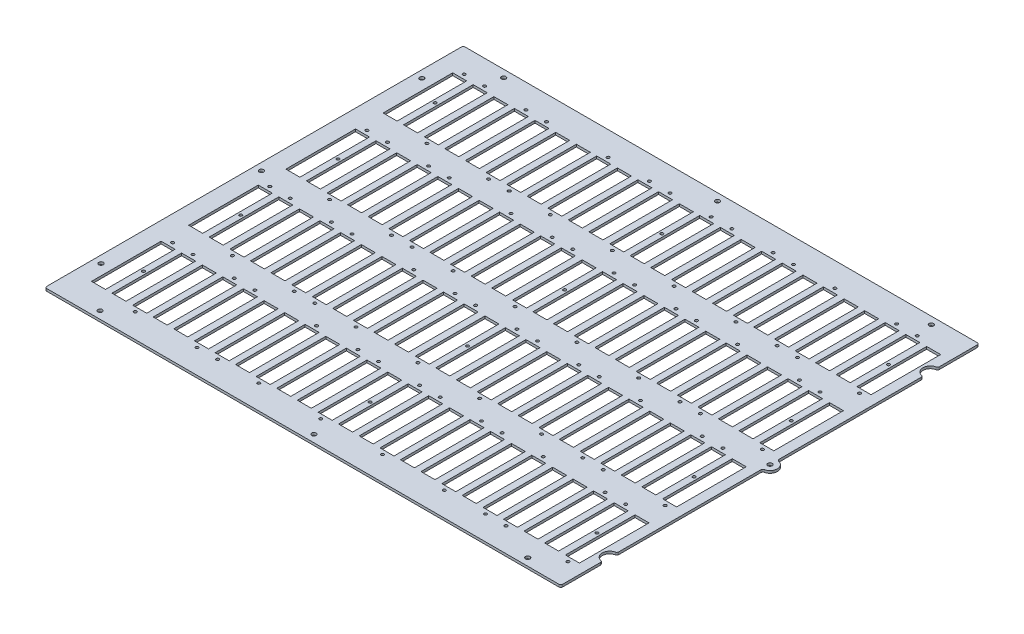
from build123d import *

# Parameters (mm, degrees)
BOSS_EXTRUDE1_DEPTH        = 3.175
SKETCH2_R                  = 1.905
SKETCH2_W                  = 18.288
SKETCH2_H                  = 90.932
CUT_EXTRUDE1_DEPTH         = 3.175
F_1_0_228_DIAMETER_HOLE1_D = 5.7912
FILLET1_R                  = 2.54
CUT_EXTRUDE3_OUTLINE_W     = 18.288
CUT_EXTRUDE3_OUTLINE_H     = 90.932
CUT_EXTRUDE3_OUTLINE_R     = 1.89865
CUT_EXTRUDE3_OUTLINE_R_2   = 2.8956
CUT_EXTRUDE3_OUTLINE_R_3   = 1.905
CUT_EXTRUDE3_DEPTH         = 3.175


# Read off the part's stored shape, not the designer's step: Cut-Extrude3
with BuildPart() as part:
    # Sketch1 → Boss-Extrude1 (new body)
    with BuildSketch(Plane(origin=(0, 0, 0), x_dir=(1, 0, 0), z_dir=(0, 1, 0))):
        with BuildLine():
            Line((337.058, 219.202), (337.058, 273.304))
            Line((337.058, 273.304), (-337.058, 273.304))
            Line((-337.058, 273.304), (-337.058, -273.304))
            Line((-337.058, -273.304), (337.058, -273.304))
            Line((337.058, -273.304), (337.058, -219.202))
            ThreePointArc((337.058, -219.202), (327.406, -209.55), (337.058, -199.898))
            Line((337.058, -199.898), (337.058, -9.652))
            ThreePointArc((337.058, -9.652), (346.71, 0), (337.058, 9.652))
            Line((337.058, 9.652), (337.058, 199.898))
            ThreePointArc((337.058, 199.898), (327.406, 209.55), (337.058, 219.202))
        make_face()
    extrude(amount=BOSS_EXTRUDE1_DEPTH)

    # Sketch2 → Cut-Extrude1 (cut)
    with BuildSketch(Plane(origin=(0, 3.175, 0), x_dir=(1, 0, 0), z_dir=(0, 1, 0))):
        with Locations(Location((-304.313166667, 241.808, 0), (0, 0, 270))):
            Circle(SKETCH2_R)
        with Locations(Location((-250.465166667, 139.192, 0), (0, 0, 270))):
            Circle(SKETCH2_R)
        with Locations(Location((-169.693166667, 139.192, 0), (0, 0, 270))):
            Circle(SKETCH2_R)
        with Locations(Location((-169.693166667, 12.192, 0), (0, 0, 270))):
            Circle(SKETCH2_R)
        with Locations(Location((-196.7865, 241.808, 0), (0, 0, 270))):
            Circle(SKETCH2_R)
        with Locations(Location((-169.693166667, -114.808, 0), (0, 0, 270))):
            Circle(SKETCH2_R)
        with Locations(Location((-169.693166667, -241.808, 0), (0, 0, 270))):
            Circle(SKETCH2_R)
        with Locations(Location((-116.1415, 241.808, 0), (0, 0, 270))):
            Circle(SKETCH2_R)
        with Locations(Location((-250.465166667, 12.192, 0), (0, 0, 270))):
            Circle(SKETCH2_R)
        with Locations(Location((-250.465166667, -114.808, 0), (0, 0, 270))):
            Circle(SKETCH2_R)
        with Locations(Location((-250.465166667, -241.808, 0), (0, 0, 270))):
            Circle(SKETCH2_R)
        with Locations(Location((-277.5585, 241.808, 0), (0, 0, 270))):
            Circle(SKETCH2_R)
        with Locations(Location((-277.5585, 114.808, 0), (0, 0, 270))):
            Circle(SKETCH2_R)
        with Locations(Location((-277.5585, -12.192, 0), (0, 0, 270))):
            Circle(SKETCH2_R)
        with Locations(Location((-277.5585, -139.192, 0), (0, 0, 270))):
            Circle(SKETCH2_R)
        with Locations(Location((-142.769166667, 139.192, 0), (0, 0, 270))):
            Circle(SKETCH2_R)
        with Locations(Location((-142.769166667, 12.192, 0), (0, 0, 270))):
            Circle(SKETCH2_R)
        with Locations(Location((-142.769166667, -114.808, 0), (0, 0, 270))):
            Circle(SKETCH2_R)
        with Locations(Location((-142.769166667, -241.808, 0), (0, 0, 270))):
            Circle(SKETCH2_R)
        with Locations(Location((-62.2935, 241.808, 0), (0, 0, 270))):
            Circle(SKETCH2_R)
        with Locations(Location((-62.2935, 114.808, 0), (0, 0, 270))):
            Circle(SKETCH2_R)
        with Locations(Location((-62.2935, -12.192, 0), (0, 0, 270))):
            Circle(SKETCH2_R)
        with Locations(Location((-62.2935, -139.192, 0), (0, 0, 270))):
            Circle(SKETCH2_R)
        with Locations(Location((-35.3695, 241.808, 0), (0, 0, 270))):
            Circle(SKETCH2_R)
        with Locations(Location((-35.3695, 114.808, 0), (0, 0, 270))):
            Circle(SKETCH2_R)
        with Locations(Location((-35.3695, -12.192, 0), (0, 0, 270))):
            Circle(SKETCH2_R)
        with Locations(Location((-35.3695, -139.192, 0), (0, 0, 270))):
            Circle(SKETCH2_R)
        with Locations(Location((-196.7865, 114.808, 0), (0, 0, 270))):
            Circle(SKETCH2_R)
        with Locations(Location((-8.149166667, 139.192, 0), (0, 0, 270))):
            Circle(SKETCH2_R)
        with Locations(Location((-8.149166667, 12.192, 0), (0, 0, 270))):
            Circle(SKETCH2_R)
        with Locations(Location((-116.1415, 114.808, 0), (0, 0, 270))):
            Circle(SKETCH2_R)
        with Locations(Location((-8.149166667, -114.808, 0), (0, 0, 270))):
            Circle(SKETCH2_R)
        with Locations(Location((-8.149166667, -241.808, 0), (0, 0, 270))):
            Circle(SKETCH2_R)
        with Locations(Location((18.4785, 241.808, 0), (0, 0, 270))):
            Circle(SKETCH2_R)
        with Locations(Location((18.4785, 114.808, 0), (0, 0, 270))):
            Circle(SKETCH2_R)
        with Locations(Location((18.4785, -12.192, 0), (0, 0, 270))):
            Circle(SKETCH2_R)
        with Locations(Location((18.4785, -139.192, 0), (0, 0, 270))):
            Circle(SKETCH2_R)
        with Locations(Location((45.4025, 241.808, 0), (0, 0, 270))):
            Circle(SKETCH2_R)
        with Locations(Location((45.4025, 114.808, 0), (0, 0, 270))):
            Circle(SKETCH2_R)
        with Locations(Location((45.4025, -12.192, 0), (0, 0, 270))):
            Circle(SKETCH2_R)
        with Locations(Location((45.4025, -139.192, 0), (0, 0, 270))):
            Circle(SKETCH2_R)
        with Locations(Location((126.1745, 241.808, 0), (0, 0, 270))):
            Circle(SKETCH2_R)
        with Locations(Location((126.1745, 114.808, 0), (0, 0, 270))):
            Circle(SKETCH2_R)
        with Locations(Location((126.1745, -12.192, 0), (0, 0, 270))):
            Circle(SKETCH2_R)
        with Locations(Location((126.1745, -139.192, 0), (0, 0, 270))):
            Circle(SKETCH2_R)
        with Locations(Location((180.0225, 241.808, 0), (0, 0, 270))):
            Circle(SKETCH2_R)
        with Locations(Location((180.0225, 114.808, 0), (0, 0, 270))):
            Circle(SKETCH2_R)
        with Locations(Location((180.0225, -12.192, 0), (0, 0, 270))):
            Circle(SKETCH2_R)
        with Locations(Location((180.0225, -139.192, 0), (0, 0, 270))):
            Circle(SKETCH2_R)
        with Locations(Location((260.7945, 241.808, 0), (0, 0, 270))):
            Circle(SKETCH2_R)
        with Locations(Location((-196.7865, -12.192, 0), (0, 0, 270))):
            Circle(SKETCH2_R)
        with Locations(Location((260.7945, 114.808, 0), (0, 0, 270))):
            Circle(SKETCH2_R)
        with Locations(Location((260.7945, -12.192, 0), (0, 0, 270))):
            Circle(SKETCH2_R)
        with Locations(Location((-116.1415, -12.192, 0), (0, 0, 270))):
            Circle(SKETCH2_R)
        with Locations(Location((260.7945, -139.192, 0), (0, 0, 270))):
            Circle(SKETCH2_R)
        with Locations(Location((287.7185, 241.808, 0), (0, 0, 270))):
            Circle(SKETCH2_R)
        with Locations(Location((287.7185, 114.808, 0), (0, 0, 270))):
            Circle(SKETCH2_R)
        with Locations(Location((287.7185, -12.192, 0), (0, 0, 270))):
            Circle(SKETCH2_R)
        with Locations(Location((287.7185, -139.192, 0), (0, 0, 270))):
            Circle(SKETCH2_R)
        with Locations(Location((72.622833333, 139.192, 0), (0, 0, 270))):
            Circle(SKETCH2_R)
        with Locations(Location((72.622833333, 12.192, 0), (0, 0, 270))):
            Circle(SKETCH2_R)
        with Locations(Location((72.622833333, -114.808, 0), (0, 0, 270))):
            Circle(SKETCH2_R)
        with Locations(Location((72.622833333, -241.808, 0), (0, 0, 270))):
            Circle(SKETCH2_R)
        with Locations(Location((153.394833333, 139.192, 0), (0, 0, 270))):
            Circle(SKETCH2_R)
        with Locations(Location((153.394833333, 12.192, 0), (0, 0, 270))):
            Circle(SKETCH2_R)
        with Locations(Location((153.394833333, -114.808, 0), (0, 0, 270))):
            Circle(SKETCH2_R)
        with Locations(Location((153.394833333, -241.808, 0), (0, 0, 270))):
            Circle(SKETCH2_R)
        with Locations(Location((207.242833333, 139.192, 0), (0, 0, 270))):
            Circle(SKETCH2_R)
        with Locations(Location((207.242833333, 12.192, 0), (0, 0, 270))):
            Circle(SKETCH2_R)
        with Locations(Location((207.242833333, -114.808, 0), (0, 0, 270))):
            Circle(SKETCH2_R)
        with Locations(Location((207.242833333, -241.808, 0), (0, 0, 270))):
            Circle(SKETCH2_R)
        with Locations(Location((314.938833333, 139.192, 0), (0, 0, 270))):
            Circle(SKETCH2_R)
        with Locations(Location((314.938833333, 12.192, 0), (0, 0, 270))):
            Circle(SKETCH2_R)
        with Locations(Location((-196.7865, -139.192, 0), (0, 0, 270))):
            Circle(SKETCH2_R)
        with Locations(Location((314.938833333, -114.808, 0), (0, 0, 270))):
            Circle(SKETCH2_R)
        with Locations(Location((314.938833333, -241.808, 0), (0, 0, 270))):
            Circle(SKETCH2_R)
        with Locations(Location((-116.1415, -139.192, 0), (0, 0, 270))):
            Circle(SKETCH2_R)
        with Locations(Location((-304.313166667, 114.808, 0), (0, 0, 270))):
            Circle(SKETCH2_R)
        with Locations(Location((-304.313166667, -12.192, 0), (0, 0, 270))):
            Circle(SKETCH2_R)
        with Locations(Location((-304.313166667, -139.192, 0), (0, 0, 270))):
            Circle(SKETCH2_R)
        with Locations((-250.465166667, 190.5)):
            Rectangle(SKETCH2_W, SKETCH2_H)
        with Locations((-169.693166667, 190.5)):
            Rectangle(SKETCH2_W, SKETCH2_H)
        with Locations((-304.313166667, 190.5)):
            Rectangle(SKETCH2_W, SKETCH2_H)
        with Locations((-169.693166667, 63.5)):
            Rectangle(SKETCH2_W, SKETCH2_H)
        with Locations((-169.693166667, -63.5)):
            Rectangle(SKETCH2_W, SKETCH2_H)
        with Locations((-196.7865, 190.5)):
            Rectangle(SKETCH2_W, SKETCH2_H)
        with Locations((-169.693166667, -190.5)):
            Rectangle(SKETCH2_W, SKETCH2_H)
        with Locations((-250.465166667, 63.5)):
            Rectangle(SKETCH2_W, SKETCH2_H)
        with Locations((-116.1415, 190.5)):
            Rectangle(SKETCH2_W, SKETCH2_H)
        with Locations((-250.465166667, -63.5)):
            Rectangle(SKETCH2_W, SKETCH2_H)
        with Locations((-250.465166667, -190.5)):
            Rectangle(SKETCH2_W, SKETCH2_H)
        with Locations((-277.5585, 190.5)):
            Rectangle(SKETCH2_W, SKETCH2_H)
        with Locations((-277.5585, 63.5)):
            Rectangle(SKETCH2_W, SKETCH2_H)
        with Locations((-277.5585, -63.5)):
            Rectangle(SKETCH2_W, SKETCH2_H)
        with Locations((-277.5585, -190.5)):
            Rectangle(SKETCH2_W, SKETCH2_H)
        with Locations((-142.769166667, 190.5)):
            Rectangle(SKETCH2_W, SKETCH2_H)
        with Locations((-142.769166667, 63.5)):
            Rectangle(SKETCH2_W, SKETCH2_H)
        with Locations((-142.769166667, -63.5)):
            Rectangle(SKETCH2_W, SKETCH2_H)
        with Locations((-142.769166667, -190.5)):
            Rectangle(SKETCH2_W, SKETCH2_H)
        with Locations((-62.2935, 190.5)):
            Rectangle(SKETCH2_W, SKETCH2_H)
        with Locations((-62.2935, 63.5)):
            Rectangle(SKETCH2_W, SKETCH2_H)
        with Locations((-62.2935, -63.5)):
            Rectangle(SKETCH2_W, SKETCH2_H)
        with Locations((-62.2935, -190.5)):
            Rectangle(SKETCH2_W, SKETCH2_H)
        with Locations((-35.3695, 190.5)):
            Rectangle(SKETCH2_W, SKETCH2_H)
        with Locations((-35.3695, 63.5)):
            Rectangle(SKETCH2_W, SKETCH2_H)
        with Locations((-35.3695, -63.5)):
            Rectangle(SKETCH2_W, SKETCH2_H)
        with Locations((-35.3695, -190.5)):
            Rectangle(SKETCH2_W, SKETCH2_H)
        with Locations((-8.149166667, 190.5)):
            Rectangle(SKETCH2_W, SKETCH2_H)
        with Locations((-196.7865, 63.5)):
            Rectangle(SKETCH2_W, SKETCH2_H)
        with Locations((-8.149166667, 63.5)):
            Rectangle(SKETCH2_W, SKETCH2_H)
        with Locations((-8.149166667, -63.5)):
            Rectangle(SKETCH2_W, SKETCH2_H)
        with Locations((-116.1415, 63.5)):
            Rectangle(SKETCH2_W, SKETCH2_H)
        with Locations((-8.149166667, -190.5)):
            Rectangle(SKETCH2_W, SKETCH2_H)
        with Locations((18.4785, 190.5)):
            Rectangle(SKETCH2_W, SKETCH2_H)
        with Locations((18.4785, 63.5)):
            Rectangle(SKETCH2_W, SKETCH2_H)
        with Locations((18.4785, -63.5)):
            Rectangle(SKETCH2_W, SKETCH2_H)
        with Locations((18.4785, -190.5)):
            Rectangle(SKETCH2_W, SKETCH2_H)
        with Locations((45.4025, 190.5)):
            Rectangle(SKETCH2_W, SKETCH2_H)
        with Locations((45.4025, 63.5)):
            Rectangle(SKETCH2_W, SKETCH2_H)
        with Locations((45.4025, -63.5)):
            Rectangle(SKETCH2_W, SKETCH2_H)
        with Locations((45.4025, -190.5)):
            Rectangle(SKETCH2_W, SKETCH2_H)
        with Locations((126.1745, 190.5)):
            Rectangle(SKETCH2_W, SKETCH2_H)
        with Locations((126.1745, 63.5)):
            Rectangle(SKETCH2_W, SKETCH2_H)
        with Locations((126.1745, -63.5)):
            Rectangle(SKETCH2_W, SKETCH2_H)
        with Locations((126.1745, -190.5)):
            Rectangle(SKETCH2_W, SKETCH2_H)
        with Locations((180.0225, 190.5)):
            Rectangle(SKETCH2_W, SKETCH2_H)
        with Locations((180.0225, 63.5)):
            Rectangle(SKETCH2_W, SKETCH2_H)
        with Locations((180.0225, -63.5)):
            Rectangle(SKETCH2_W, SKETCH2_H)
        with Locations((180.0225, -190.5)):
            Rectangle(SKETCH2_W, SKETCH2_H)
        with Locations((260.7945, 190.5)):
            Rectangle(SKETCH2_W, SKETCH2_H)
        with Locations((260.7945, 63.5)):
            Rectangle(SKETCH2_W, SKETCH2_H)
        with Locations((-196.7865, -63.5)):
            Rectangle(SKETCH2_W, SKETCH2_H)
        with Locations((260.7945, -63.5)):
            Rectangle(SKETCH2_W, SKETCH2_H)
        with Locations((260.7945, -190.5)):
            Rectangle(SKETCH2_W, SKETCH2_H)
        with Locations((-116.1415, -63.5)):
            Rectangle(SKETCH2_W, SKETCH2_H)
        with Locations((287.7185, 190.5)):
            Rectangle(SKETCH2_W, SKETCH2_H)
        with Locations((287.7185, 63.5)):
            Rectangle(SKETCH2_W, SKETCH2_H)
        with Locations((287.7185, -63.5)):
            Rectangle(SKETCH2_W, SKETCH2_H)
        with Locations((287.7185, -190.5)):
            Rectangle(SKETCH2_W, SKETCH2_H)
        with Locations((72.622833333, 190.5)):
            Rectangle(SKETCH2_W, SKETCH2_H)
        with Locations((72.622833333, 63.5)):
            Rectangle(SKETCH2_W, SKETCH2_H)
        with Locations((72.622833333, -63.5)):
            Rectangle(SKETCH2_W, SKETCH2_H)
        with Locations((72.622833333, -190.5)):
            Rectangle(SKETCH2_W, SKETCH2_H)
        with Locations((153.394833333, 190.5)):
            Rectangle(SKETCH2_W, SKETCH2_H)
        with Locations((153.394833333, 63.5)):
            Rectangle(SKETCH2_W, SKETCH2_H)
        with Locations((153.394833333, -63.5)):
            Rectangle(SKETCH2_W, SKETCH2_H)
        with Locations((153.394833333, -190.5)):
            Rectangle(SKETCH2_W, SKETCH2_H)
        with Locations((207.242833333, 190.5)):
            Rectangle(SKETCH2_W, SKETCH2_H)
        with Locations((207.242833333, 63.5)):
            Rectangle(SKETCH2_W, SKETCH2_H)
        with Locations((207.242833333, -63.5)):
            Rectangle(SKETCH2_W, SKETCH2_H)
        with Locations((207.242833333, -190.5)):
            Rectangle(SKETCH2_W, SKETCH2_H)
        with Locations((314.938833333, 190.5)):
            Rectangle(SKETCH2_W, SKETCH2_H)
        with Locations((314.938833333, 63.5)):
            Rectangle(SKETCH2_W, SKETCH2_H)
        with Locations((-196.7865, -190.5)):
            Rectangle(SKETCH2_W, SKETCH2_H)
        with Locations((314.938833333, -63.5)):
            Rectangle(SKETCH2_W, SKETCH2_H)
        with Locations((314.938833333, -190.5)):
            Rectangle(SKETCH2_W, SKETCH2_H)
        with Locations((-116.1415, -190.5)):
            Rectangle(SKETCH2_W, SKETCH2_H)
        with Locations((-304.313166667, 63.5)):
            Rectangle(SKETCH2_W, SKETCH2_H)
        with Locations((-304.313166667, -63.5)):
            Rectangle(SKETCH2_W, SKETCH2_H)
        with Locations((-304.313166667, -190.5)):
            Rectangle(SKETCH2_W, SKETCH2_H)
    extrude(amount=-CUT_EXTRUDE1_DEPTH, mode=Mode.SUBTRACT)

    # #1 (0.228) Diameter Hole1 (through all)
    with Locations(Plane(origin=(0, 3.175, 0), x_dir=(1, 0, 0), z_dir=(0, 1, 0))):
        with Locations((337.058, 0)):
            Hole(F_1_0_228_DIAMETER_HOLE1_D / 2)

    # Fillet1
    fillet1_edges = [part.edges().sort_by_distance(p)[0] for p in [
        (337.058, 1.5875, -273.304),
        (337.058, 1.5875, -219.202),
        (337.058, 1.5875, -199.898),
        (337.058, 1.5875, -9.652),
        (337.058, 1.5875, 9.652),
        (337.058, 1.5875, 199.898),
        (337.058, 1.5875, 219.202),
        (337.058, 1.5875, 273.304),
        (-337.058, 1.5875, 273.304),
        (-337.058, 1.5875, -273.304),
    ]]
    fillet(fillet1_edges, radius=FILLET1_R)

    # Cut-Extrude3 outline → Cut-Extrude3 (cut)
    with BuildSketch(Plane(origin=(0, 0, 0), x_dir=(1, 0, 0), z_dir=(0, 1, 0))):
        with Locations((233.9975, 190.5)):
            Rectangle(CUT_EXTRUDE3_OUTLINE_W, CUT_EXTRUDE3_OUTLINE_H)
        with Locations((99.3775, 190.5)):
            Rectangle(CUT_EXTRUDE3_OUTLINE_W, CUT_EXTRUDE3_OUTLINE_H)
        with Locations((-223.7105, 190.5)):
            Rectangle(CUT_EXTRUDE3_OUTLINE_W, CUT_EXTRUDE3_OUTLINE_H)
        with Locations((-89.0905, 190.5)):
            Rectangle(CUT_EXTRUDE3_OUTLINE_W, CUT_EXTRUDE3_OUTLINE_H)
        with Locations((-223.7105, -190.5)):
            Rectangle(CUT_EXTRUDE3_OUTLINE_W, CUT_EXTRUDE3_OUTLINE_H)
        with Locations((-89.0905, -190.5)):
            Rectangle(CUT_EXTRUDE3_OUTLINE_W, CUT_EXTRUDE3_OUTLINE_H)
        with Locations((233.9975, -190.5)):
            Rectangle(CUT_EXTRUDE3_OUTLINE_W, CUT_EXTRUDE3_OUTLINE_H)
        with Locations((99.3775, -190.5)):
            Rectangle(CUT_EXTRUDE3_OUTLINE_W, CUT_EXTRUDE3_OUTLINE_H)
        with Locations((-223.7105, -63.5)):
            Rectangle(CUT_EXTRUDE3_OUTLINE_W, CUT_EXTRUDE3_OUTLINE_H)
        with Locations((-89.0905, -63.5)):
            Rectangle(CUT_EXTRUDE3_OUTLINE_W, CUT_EXTRUDE3_OUTLINE_H)
        with Locations((233.9975, -63.5)):
            Rectangle(CUT_EXTRUDE3_OUTLINE_W, CUT_EXTRUDE3_OUTLINE_H)
        with Locations((99.3775, -63.5)):
            Rectangle(CUT_EXTRUDE3_OUTLINE_W, CUT_EXTRUDE3_OUTLINE_H)
        with Locations((233.9975, 63.5)):
            Rectangle(CUT_EXTRUDE3_OUTLINE_W, CUT_EXTRUDE3_OUTLINE_H)
        with Locations((-89.0905, 63.5)):
            Rectangle(CUT_EXTRUDE3_OUTLINE_W, CUT_EXTRUDE3_OUTLINE_H)
        with Locations((-223.7105, 63.5)):
            Rectangle(CUT_EXTRUDE3_OUTLINE_W, CUT_EXTRUDE3_OUTLINE_H)
        with Locations((99.3775, 63.5)):
            Rectangle(CUT_EXTRUDE3_OUTLINE_W, CUT_EXTRUDE3_OUTLINE_H)
        with Locations((-290.935833333, -190.5)):
            Circle(CUT_EXTRUDE3_OUTLINE_R)
        with Locations((-290.935833333, -63.5)):
            Circle(CUT_EXTRUDE3_OUTLINE_R)
        with Locations((-290.935833333, 63.5)):
            Circle(CUT_EXTRUDE3_OUTLINE_R)
        with Locations((301.392166667, -190.5)):
            Circle(CUT_EXTRUDE3_OUTLINE_R)
        with Locations((5.228166667, -190.5)):
            Circle(CUT_EXTRUDE3_OUTLINE_R)
        with Locations((301.392166667, -63.5)):
            Circle(CUT_EXTRUDE3_OUTLINE_R)
        with Locations((5.228166667, -63.5)):
            Circle(CUT_EXTRUDE3_OUTLINE_R)
        with Locations((301.392166667, 63.5)):
            Circle(CUT_EXTRUDE3_OUTLINE_R)
        with Locations((5.228166667, 63.5)):
            Circle(CUT_EXTRUDE3_OUTLINE_R)
        with Locations((301.392166667, 190.5)):
            Circle(CUT_EXTRUDE3_OUTLINE_R)
        with Locations((5.228166667, 190.5)):
            Circle(CUT_EXTRUDE3_OUTLINE_R)
        with Locations((-290.935833333, 190.5)):
            Circle(CUT_EXTRUDE3_OUTLINE_R)
        with Locations((4.826, 263.652)):
            Circle(CUT_EXTRUDE3_OUTLINE_R_2)
        with Locations((-274.574, 263.652)):
            Circle(CUT_EXTRUDE3_OUTLINE_R_2)
        with Locations((-327.406, 209.55)):
            Circle(CUT_EXTRUDE3_OUTLINE_R_2)
        with Locations((-327.406, 0)):
            Circle(CUT_EXTRUDE3_OUTLINE_R_2)
        with Locations((-327.406, -209.55)):
            Circle(CUT_EXTRUDE3_OUTLINE_R_2)
        with Locations((-274.574, -263.652)):
            Circle(CUT_EXTRUDE3_OUTLINE_R_2)
        with Locations((4.826, -263.652)):
            Circle(CUT_EXTRUDE3_OUTLINE_R_2)
        with Locations((284.226, -263.652)):
            Circle(CUT_EXTRUDE3_OUTLINE_R_2)
        with Locations((284.226, 263.652)):
            Circle(CUT_EXTRUDE3_OUTLINE_R_2)
        with Locations((-223.7105, -12.192)):
            Circle(CUT_EXTRUDE3_OUTLINE_R_3)
        with Locations((-223.7105, 114.808)):
            Circle(CUT_EXTRUDE3_OUTLINE_R_3)
        with Locations((99.3775, 241.808)):
            Circle(CUT_EXTRUDE3_OUTLINE_R_3)
        with Locations((-223.7105, -139.192)):
            Circle(CUT_EXTRUDE3_OUTLINE_R_3)
        with Locations((-223.7105, 241.808)):
            Circle(CUT_EXTRUDE3_OUTLINE_R_3)
        with Locations((-89.0905, 139.192)):
            Circle(CUT_EXTRUDE3_OUTLINE_R_3)
        with Locations((233.9975, 139.192)):
            Circle(CUT_EXTRUDE3_OUTLINE_R_3)
        with Locations((233.9975, 12.192)):
            Circle(CUT_EXTRUDE3_OUTLINE_R_3)
        with Locations((233.9975, -114.808)):
            Circle(CUT_EXTRUDE3_OUTLINE_R_3)
        with Locations((-89.0905, -241.808)):
            Circle(CUT_EXTRUDE3_OUTLINE_R_3)
        with Locations((-89.0905, -114.808)):
            Circle(CUT_EXTRUDE3_OUTLINE_R_3)
        with Locations((-89.0905, 12.192)):
            Circle(CUT_EXTRUDE3_OUTLINE_R_3)
        with Locations((233.9975, -241.808)):
            Circle(CUT_EXTRUDE3_OUTLINE_R_3)
        with Locations((99.3775, 114.808)):
            Circle(CUT_EXTRUDE3_OUTLINE_R_3)
        with Locations((99.3775, -12.192)):
            Circle(CUT_EXTRUDE3_OUTLINE_R_3)
        with Locations((99.3775, -139.192)):
            Circle(CUT_EXTRUDE3_OUTLINE_R_3)
    extrude(amount=CUT_EXTRUDE3_DEPTH, mode=Mode.SUBTRACT)


solid = part.part
